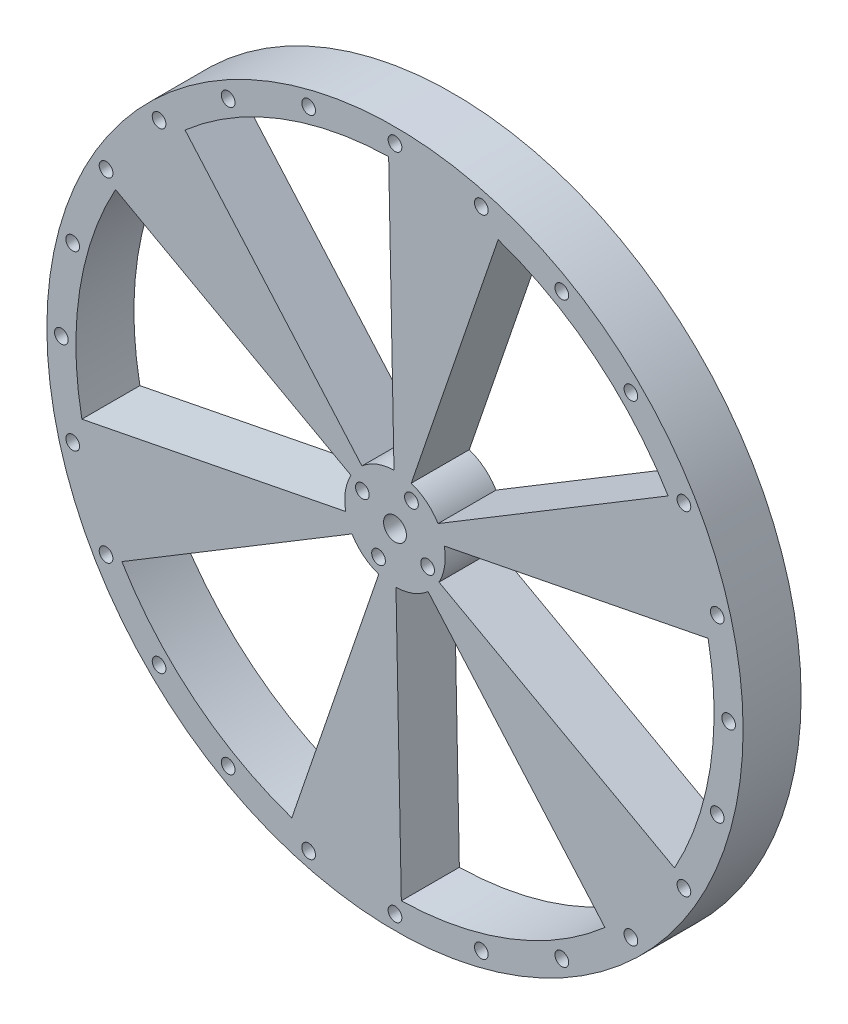
from build123d import *

# Parameters (mm, degrees)
SKETCH2_R           = 76.2
BOSS_EXTRUDE1_DEPTH = 12.7
SKETCH3_R           = 2.499999953
CUT_EXTRUDE1_DEPTH  = 109.508847566
SKETCH4_R           = 1.500000048
CUT_EXTRUDE2_DEPTH  = 109.508847566
CIRPATTERN1_COUNT   = 4
SKETCH5_R           = 1.500000048
CUT_EXTRUDE3_DEPTH  = 109.508847566
CIRPATTERN2_COUNT   = 24


with BuildPart() as part:
    # Sketch2 → Boss-Extrude1 (new body)
    with BuildSketch(Plane.XY):
        Circle(SKETCH2_R)
    extrude(amount=BOSS_EXTRUDE1_DEPTH)

    # Sketch3 → Cut-Extrude1 (cut, through all)
    with BuildSketch(Plane.XY.offset(12.7)):
        with BuildLine():
            Line((-45.951164265, 52.607157333), (-7.236403802, 8.284591684))
            ThreePointArc((-7.236403802, 8.284591684), (-3.966498019, 10.259965537), (-0.218174035, 10.997836126))
            Line((-0.218174035, 10.997836126), (-1.385405125, 69.836259584))
            ThreePointArc((-1.385405125, 69.836259584), (-25.187262485, 65.150781335), (-45.951164265, 52.607157333))
        make_face()
        Circle(SKETCH3_R)
        with BuildLine():
            Line((22.583552539, 66.098454254), (3.556464957, 10.409205367))
            ThreePointArc((3.556464957, 10.409205367), (6.902141788, 8.565070817), (9.415318454, 5.68786232))
            Line((9.415318454, 5.68786232), (59.787272342, 36.117925825))
            ThreePointArc((59.787272342, 36.117925825), (43.82860047, 54.388199831), (22.583552539, 66.098454254))
        make_face()
        with BuildLine():
            ThreePointArc((-10.79286876, -2.124613683), (-10.868639807, 1.69489472), (-9.633492489, 5.309973806))
            Line((-9.633492489, 5.309973806), (-61.172677467, 33.718333759))
            ThreePointArc((-61.172677467, 33.718333759), (-69.015862955, 10.762581503), (-68.534716804, -13.49129692))
            Line((-68.534716804, -13.49129692), (-10.79286876, -2.124613683))
        make_face()
        with BuildLine():
            Line((-22.583552539, -66.098454254), (-3.556464957, -10.409205367))
            ThreePointArc((-3.556464957, -10.409205367), (-6.902141788, -8.565070817), (-9.415318454, -5.68786232))
            Line((-9.415318454, -5.68786232), (-59.787272342, -36.117925825))
            ThreePointArc((-59.787272342, -36.117925825), (-43.82860047, -54.388199831), (-22.583552539, -66.098454254))
        make_face()
        with BuildLine():
            Line((45.951164265, -52.607157333), (7.236403802, -8.284591684))
            ThreePointArc((7.236403802, -8.284591684), (3.966498019, -10.259965537), (0.218174035, -10.997836126))
            Line((0.218174035, -10.997836126), (1.385405125, -69.836259584))
            ThreePointArc((1.385405125, -69.836259584), (25.187262485, -65.150781335), (45.951164265, -52.607157333))
        make_face()
        with BuildLine():
            ThreePointArc((10.79286876, 2.124613683), (10.868639807, -1.69489472), (9.633492489, -5.309973806))
            Line((9.633492489, -5.309973806), (61.172677467, -33.718333759))
            ThreePointArc((61.172677467, -33.718333759), (69.015862955, -10.762581503), (68.534716804, 13.49129692))
            Line((68.534716804, 13.49129692), (10.79286876, 2.124613683))
        make_face()
    extrude(amount=-CUT_EXTRUDE1_DEPTH, mode=Mode.SUBTRACT)

    # Sketch4 → Cut-Extrude2 (cut, through all)
    with BuildSketch(Plane.XY.offset(12.7)):
        with Locations((3.6051017, 7.141655394)):
            Circle(SKETCH4_R)
    cut_extrude2 = extrude(amount=-CUT_EXTRUDE2_DEPTH, mode=Mode.SUBTRACT)

    # CirPattern1: Cut-Extrude2 ×4 about axis
    cirpattern1_axis = Axis((0, 0, 12.7), (0, 0, 1))
    for i in range(1, CIRPATTERN1_COUNT):
        add(cut_extrude2.rotate(cirpattern1_axis, i * 360 / CIRPATTERN1_COUNT), mode=Mode.SUBTRACT)

    # Sketch5 → Cut-Extrude3 (cut, through all)
    with BuildSketch(Plane.XY.offset(12.7)):
        with Locations((0, 73.025)):
            Circle(SKETCH5_R)
    cut_extrude3 = extrude(amount=-CUT_EXTRUDE3_DEPTH, mode=Mode.SUBTRACT)

    # CirPattern2: Cut-Extrude3 ×24 about axis
    cirpattern2_axis = Axis((0, 0, 12.7), (0, 0, 1))
    for i in range(1, CIRPATTERN2_COUNT):
        add(cut_extrude3.rotate(cirpattern2_axis, i * 360 / CIRPATTERN2_COUNT), mode=Mode.SUBTRACT)


solid = part.part
